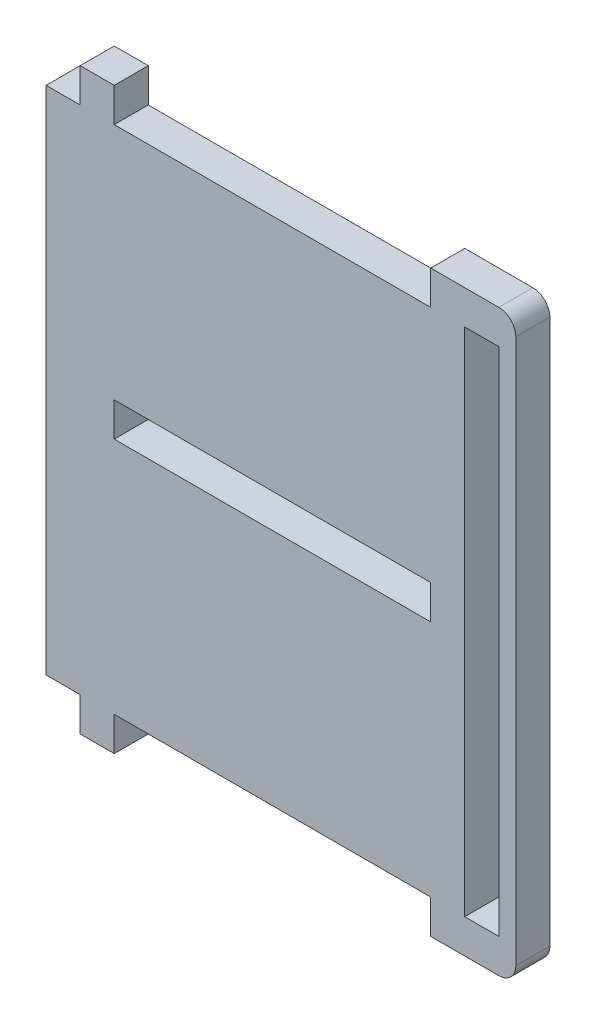
from build123d import *

# Parameters (mm, degrees)
SKETCH1_W           = 59.0248375
SKETCH1_H           = 6.35
SKETCH1_W_2         = 6.35
SKETCH1_H_2         = 95.25
BOSS_EXTRUDE1_DEPTH = 6.35


with BuildPart() as part:
    # Sketch1 → Boss-Extrude1 (new body)
    with BuildSketch(Plane.XY):
        with BuildLine():
            Line((-36.4109, 0), (-30.0609, 0))
            Line((-30.0609, 0), (-30.0609, 6.35))
            Line((-30.0609, 6.35), (28.9639375, 6.35))
            Line((28.9639375, 6.35), (28.9639375, 0))
            Line((28.9639375, 0), (41.6639375, 0))
            ThreePointArc((41.6639375, 0), (43.90900153, 0.92993597), (44.8389375, 3.175))
            Line((44.8389375, 3.175), (44.8389375, 104.775))
            ThreePointArc((44.8389375, 104.775), (43.90900153, 107.02006403), (41.6639375, 107.95))
            Line((41.6639375, 107.95), (28.9639375, 107.95))
            Line((28.9639375, 107.95), (28.9639375, 101.6))
            Line((28.9639375, 101.6), (-30.0609, 101.6))
            Line((-30.0609, 101.6), (-30.0609, 107.95))
            Line((-30.0609, 107.95), (-36.4109, 107.95))
            Line((-36.4109, 107.95), (-36.4109, 101.6))
            Line((-36.4109, 101.6), (-42.7609, 101.6))
            Line((-42.7609, 101.6), (-42.7609, 6.35))
            Line((-42.7609, 6.35), (-36.4109, 6.35))
            Line((-36.4109, 6.35), (-36.4109, 0))
        make_face()
        with Locations((-0.54848125, 53.975)):
            Rectangle(SKETCH1_W, SKETCH1_H, mode=Mode.SUBTRACT)
        with Locations((38.4889375, 53.975)):
            Rectangle(SKETCH1_W_2, SKETCH1_H_2, mode=Mode.SUBTRACT)
    extrude(amount=BOSS_EXTRUDE1_DEPTH)


solid = part.part
